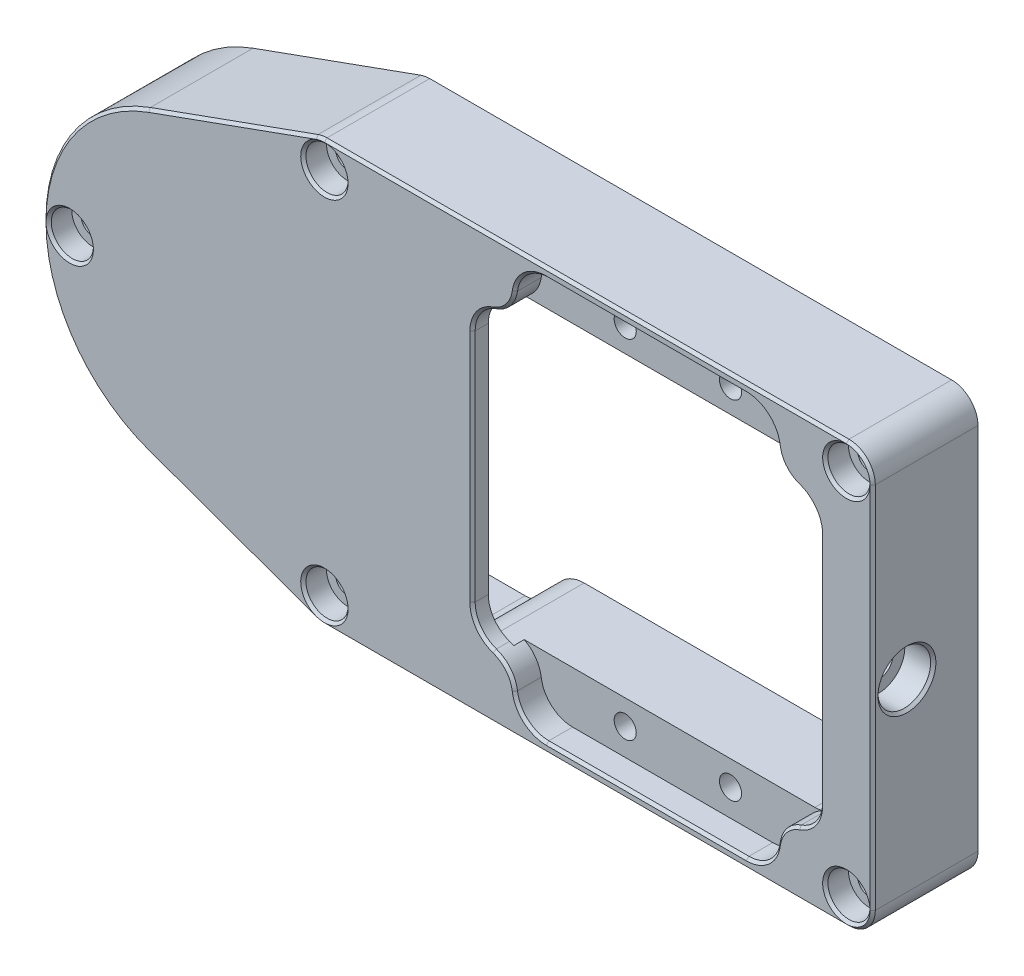
from build123d import *

# Parameters (mm, degrees)
BOSS_EXTRUDE1_DEPTH                                 = 20
FILLET1_R                                           = 5
CBORE_FOR_M4_HEX_SOCKET_HEAD_CAP_SCREW1_D           = 4.5
CBORE_FOR_M4_HEX_SOCKET_HEAD_CAP_SCREW1_CBORE_D     = 8
CBORE_FOR_M4_HEX_SOCKET_HEAD_CAP_SCREW1_CBORE_DEPTH = 4.4
CUT_EXTRUDE3_DEPTH                                  = 5
CUT_EXTRUDE4_DEPTH                                  = 94.841621896
FILLET4_R                                           = 6
FILLET5_R                                           = 6
CUT_EXTRUDE1_DEPTH                                  = 17
FILLET2_R                                           = 6
FILLET6_R                                           = 6
TAP_DRILL_FOR_M5_TAP1_D                             = 4.2
TAP_DRILL_FOR_M5_TAP1_DEPTH                         = 10
TAP_DRILL_FOR_M5_TAP1_TIP                           = 1.2618073
CBORE_FOR_M5_HEX_SOCKET_HEAD_CAP_SCREW2_D           = 5.5
CBORE_FOR_M5_HEX_SOCKET_HEAD_CAP_SCREW2_DEPTH       = 20
CBORE_FOR_M5_HEX_SOCKET_HEAD_CAP_SCREW2_CBORE_D     = 10
CBORE_FOR_M5_HEX_SOCKET_HEAD_CAP_SCREW2_CBORE_DEPTH = 5.4
CBORE_FOR_M5_HEX_SOCKET_HEAD_CAP_SCREW2_TIP         = 1.652366702
CHAMFER1_SIZE                                       = 0.5


# Some blends are built 0.0001 mm under size
with BuildPart() as part:
    # Sketch2 → Boss-Extrude1 (new body)
    with BuildSketch(Plane.XY):
        with BuildLine():
            Line((-30, 40), (75, 40))
            Line((75, 40), (75, -40))
            Line((75, -40), (-30, -40))
            Line((-30, -40), (-62.673213991, -28.22243287))
            ThreePointArc((-62.673213991, -28.22243287), (-82.5, 0), (-62.673213991, 28.22243287))
            Line((-62.673213991, 28.22243287), (-30, 40))
        make_face()
    extrude(amount=BOSS_EXTRUDE1_DEPTH)

    # Fillet1
    fillet1_edges = [part.edges().sort_by_distance(p)[0] for p in [
        (-30, -40, 10),
        (-30, 40, 10),
        (75, 40, 10),
        (75, -40, 10),
    ]]
    fillet(fillet1_edges, radius=FILLET1_R)

    # CBORE for M4 Hex Socket Head Cap Screw1 (through all)
    with Locations(Plane(origin=(-29.126349288, 35, 20), x_dir=(1, 0, 0), z_dir=(0, 0, 1))):
        with Locations((0, 0), (0, -70), (99.126349288, 0), (99.126349288, -70), (-48.373650712, -35.049755237)):
            CounterBoreHole(CBORE_FOR_M4_HEX_SOCKET_HEAD_CAP_SCREW1_D / 2, CBORE_FOR_M4_HEX_SOCKET_HEAD_CAP_SCREW1_CBORE_D / 2, CBORE_FOR_M4_HEX_SOCKET_HEAD_CAP_SCREW1_CBORE_DEPTH)

    # Sketch10 → Cut-Extrude3 (cut)
    with BuildSketch(Plane.XY.offset(20)):
        Polygon((7, -28.3), (65, -28.3), (65, 28.3), (7, 28.3), (-1, 28.3), (-1, -28.3), align=None)
        Polygon((57, -38.1), (15, -38.1), (7, -38.1), (7, 38.1), (15, 38.1), (57, 38.1), align=None)
    extrude(amount=-CUT_EXTRUDE3_DEPTH, mode=Mode.SUBTRACT)

    # Sketch10<4> → Cut-Extrude4 (cut, through all)
    with BuildSketch(Plane.XY.offset(20)):
        Polygon((7, -28.3), (65, -28.3), (65, 28.3), (7, 28.3), (-1, 28.3), (-1, -28.3), align=None)
    extrude(amount=-CUT_EXTRUDE4_DEPTH, mode=Mode.SUBTRACT)

    # Fillet4
    fillet4_edges = [part.edges().sort_by_distance(p)[0] for p in [
        (65, 28.3, 10),
        (65, -28.3, 10),
        (57, -38.1, 17.5),
        (7, -38.1, 17.5),
        (-1, -28.3, 10),
        (-1, 28.3, 10),
        (7, 38.1, 17.5),
        (57, 38.1, 17.5),
    ]]
    fillet(fillet4_edges, radius=FILLET4_R)

    # Fillet5
    # the kernel refuses this fillet: 6 mm, written as the material it takes off along each edge
    with BuildSketch(Plane(origin=(7, 28.3, 31.436550577), x_dir=(-0.9966183944804063, -0.08216918998807972, 0), z_dir=(0, 0, -1)), Plane(origin=(57, 28.3, 15), x_dir=(0.9966183944804067, -0.08216918998807658, 0), z_dir=(0, 0, 1)), Plane(origin=(57, -28.3, 31.436550577), x_dir=(0.9966183944804065, 0.0821691899880794, 0), z_dir=(0, 0, -1)), Plane(origin=(7, -28.3, 15), x_dir=(-0.9966183944804063, 0.08216918998808052, 0), z_dir=(0, 0, 1))) as fillet5_piece_1:
        with BuildLine():
            CenterArc((5.44019753, 5.815371987), FILLET5_R, 192.12839437, 63.621083031)
            Line((-0.425877879, 4.554753373), (-1.01248542, 4.428691512))
            ThreePointArc((-1.01248542, 4.428691512), (-0.910213959, 3.737848385), (-0.597971037, -0.049301514))
            Line((-0.597971037, -0.049301514), (0.049301514, -0.597971037))
            ThreePointArc((0.049301514, -0.597971037), (2.042538303, -0.433632657), (3.815527449, -0.581537199))
            Line((3.815527449, -0.581537199), (3.96322473, 0))
        make_face()
    extrude(amount=16.436550577, mode=Mode.SUBTRACT)

    # Sketch8 → Cut-Extrude1 (cut)
    with BuildSketch(Plane(origin=(0, 0, 0), x_dir=(-1, 0, 0), z_dir=(0, 0, -1))):
        with BuildLine():
            Line((-59, 28.3), (5, 28.3))
            Line((5, 28.3), (5, 36))
            Line((5, 36), (22.956867948, 36))
            ThreePointArc((22.956867948, 36), (28.050584319, 28.843277679), (35.269382186, 33.848632633))
            Line((35.269382186, 33.848632633), (61.316785459, 24.459441821))
            ThreePointArc((61.316785459, 24.459441821), (71.827476782, 17.391050607), (77.751129252, 6.195197453))
            ThreePointArc((77.751129252, 6.195197453), (71.250012378, -0.037316452), (77.726269833, -6.295658051))
            ThreePointArc((77.726269833, -6.295658051), (71.79282674, -17.429481816), (61.316785459, -24.459441821))
            Line((61.316785459, -24.459441821), (35.269382186, -33.848632633))
            ThreePointArc((35.269382186, -33.848632633), (28.050584319, -28.843277679), (22.956867948, -36))
            Line((22.956867948, -36), (5, -36))
            Line((5, -36), (5, -28.3))
            Line((5, -28.3), (-59, -28.3))
            ThreePointArc((-59, -28.3), (-63.242640687, -26.542640687), (-65, -22.3))
            Line((-65, -22.3), (-65, 22.3))
            ThreePointArc((-65, 22.3), (-63.242640687, 26.542640687), (-59, 28.3))
        make_face()
    extrude(amount=-CUT_EXTRUDE1_DEPTH, mode=Mode.SUBTRACT)

    # Fillet2
    fillet2_edges = [part.edges().sort_by_distance(p)[0] for p in [
        (-35.269382186, 33.848632633, 8.5),
        (-22.956867948, 36, 8.5),
        (-5, 36, 8.5),
        (-5, -36, 8.5),
        (-22.956867948, -36, 8.5),
        (-35.269382186, -33.848632633, 8.5),
        (-77.726269833, -6.295658051, 8.5),
        (-77.751129252, 6.195197453, 8.5),
    ]]
    fillet(fillet2_edges, radius=FILLET2_R)

    # Fillet6
    fillet6_edges = [part.edges().sort_by_distance(p)[0] for p in [
        (-5, -28.3, 8.5),
        (-5, 28.3, 8.5),
    ]]
    fillet(fillet6_edges, radius=FILLET6_R)

    # Tap Drill for M5 Tap1
    with Locations(Plane.XY.offset(15)):
        with Locations((43, -33), (33, 0), (43, 33), (23, -33), (23, 33)):
            Hole(TAP_DRILL_FOR_M5_TAP1_D / 2, depth=TAP_DRILL_FOR_M5_TAP1_DEPTH)
            with Locations((0, 0, -(TAP_DRILL_FOR_M5_TAP1_DEPTH + TAP_DRILL_FOR_M5_TAP1_TIP / 2))):  # 118° drill point
                Cone(0, TAP_DRILL_FOR_M5_TAP1_D / 2, TAP_DRILL_FOR_M5_TAP1_TIP, mode=Mode.SUBTRACT)

    # CBORE for M5 Hex Socket Head Cap Screw2
    with Locations(Plane(origin=(75, 0, 0), x_dir=(0, 0, -1), z_dir=(1, 0, 0))):
        with Locations((-13.5, 0)):
            CounterBoreHole(CBORE_FOR_M5_HEX_SOCKET_HEAD_CAP_SCREW2_D / 2, CBORE_FOR_M5_HEX_SOCKET_HEAD_CAP_SCREW2_CBORE_D / 2, CBORE_FOR_M5_HEX_SOCKET_HEAD_CAP_SCREW2_CBORE_DEPTH, depth=CBORE_FOR_M5_HEX_SOCKET_HEAD_CAP_SCREW2_DEPTH)
            with Locations((0, 0, -(CBORE_FOR_M5_HEX_SOCKET_HEAD_CAP_SCREW2_DEPTH + CBORE_FOR_M5_HEX_SOCKET_HEAD_CAP_SCREW2_TIP / 2))):  # 118° drill point
                Cone(0, CBORE_FOR_M5_HEX_SOCKET_HEAD_CAP_SCREW2_D / 2, CBORE_FOR_M5_HEX_SOCKET_HEAD_CAP_SCREW2_TIP, mode=Mode.SUBTRACT)

    # Chamfer1
    chamfer1_edges = [part.edges().sort_by_distance(p)[0] for p in [
        (65, 0, 20),
        (32, -38.1, 20),
        (-82.5, 0, 20),
        (-1, 0, 20),
        (32, 38.1, 20),
        (63.883591711, -25.785761323, 20),
        (9.040585283, -36.608107708, 20),
        (0.116408289, 25.785761323, 20),
        (54.959414717, 36.608107708, 20),
        (-46.747549472, 33.963085841, 20),
        (-46.747549472, -33.963085841, 20),
        (63.883591711, 25.785761323, 20),
        (54.959414717, -36.608107708, 20),
        (0.116408289, -25.785761323, 20),
        (9.040585283, 36.608107708, 20),
        (5.748321867, -29.854431129, 20),
        (58.251678133, -29.854431129, 20),
        (58.251678133, 29.854431129, 20),
        (5.748321867, 29.854431129, 20),
        (20.436825356, 40, 20),
        (20.436825356, -40, 20),
        (75, 0, 20),
        (-29.986961262, -39.925377856, 20),
        (73.535533906, -38.535533906, 20),
        (73.535533906, 38.535533906, 20),
        (-29.986961262, 39.925377856, 20),
        (75, 0, 18.5),
        (-81.5, -0.049755237, 20),
        (66, -35, 20),
        (66, 35, 20),
        (-33.126349288, -35, 20),
        (-33.126349288, 35, 20),
    ]]
    chamfer(chamfer1_edges, length=CHAMFER1_SIZE - 0.0001)  # a hair under: the kernel refuses the full size


solid = part.part
